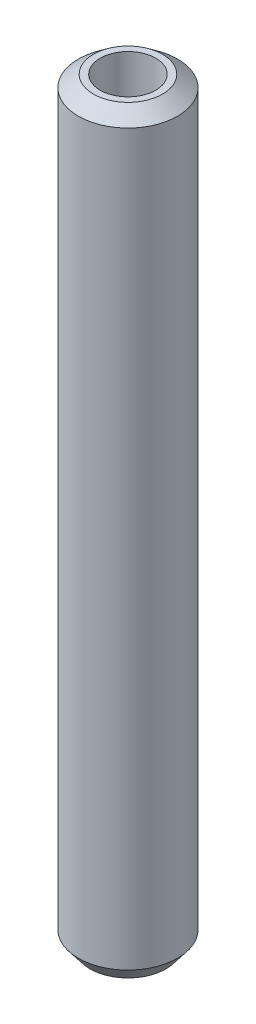
from build123d import *
from OCP.BRepFilletAPI import BRepFilletAPI_MakeChamfer

# Parameters (mm, degrees)
SKETCH1_R           = 20
BOSS_EXTRUDE1_DEPTH = 304.877717206
SKETCH2_R           = 11.207745511
CUT_EXTRUDE1_DEPTH  = 307.186907703
CHAMFER1_SIZE       = 4.690630038
CHAMFER1_SIZE2      = 6.075112319


with BuildPart() as part:
    # Sketch1 → Boss-Extrude1 (new body)
    with BuildSketch(Plane(origin=(0, 0, 0), x_dir=(1, 0, 0), z_dir=(0, 1, 0))):
        Circle(SKETCH1_R)
    extrude(amount=BOSS_EXTRUDE1_DEPTH)

    # Sketch2 → Cut-Extrude1 (cut, through all)
    with BuildSketch(Plane(origin=(0, 0, 0), x_dir=(1, 0, 0), z_dir=(0, 1, 0))):
        Circle(SKETCH2_R)
    extrude(amount=CUT_EXTRUDE1_DEPTH, mode=Mode.SUBTRACT)

    # Chamfer1: one chamfer whose edges measure the first distance from different faces: ONE call of the kernel's chamfer builder (chamfer() names one face for all edges)
    chamfer1_edges_1 = [part.edges().sort_by_distance(p)[0] for p in [
        (-20, 304.877717206, 0),
    ]]
    chamfer1_side_1 = [part.faces().sort_by_distance(p)[0] for p in [
        (-20, 152.438858603, 0),
    ]]
    chamfer1_edges_2 = [part.edges().sort_by_distance(p)[0] for p in [
        (-20, 0, 0),
    ]]
    chamfer1_side_2 = [part.faces().sort_by_distance(p)[0] for p in [
        (-19.434314575, 0, 0),
    ]]
    chamfer1 = BRepFilletAPI_MakeChamfer(part.part.solid().wrapped)
    for e in chamfer1_edges_1:
        chamfer1.Add(CHAMFER1_SIZE, CHAMFER1_SIZE2, e.wrapped, chamfer1_side_1[0].wrapped)  # the first distance lies on this face
    for e in chamfer1_edges_2:
        chamfer1.Add(CHAMFER1_SIZE, CHAMFER1_SIZE2, e.wrapped, chamfer1_side_2[0].wrapped)  # the first distance lies on this face
    add(Compound.cast(chamfer1.Shape()), mode=Mode.REPLACE)


solid = part.part
